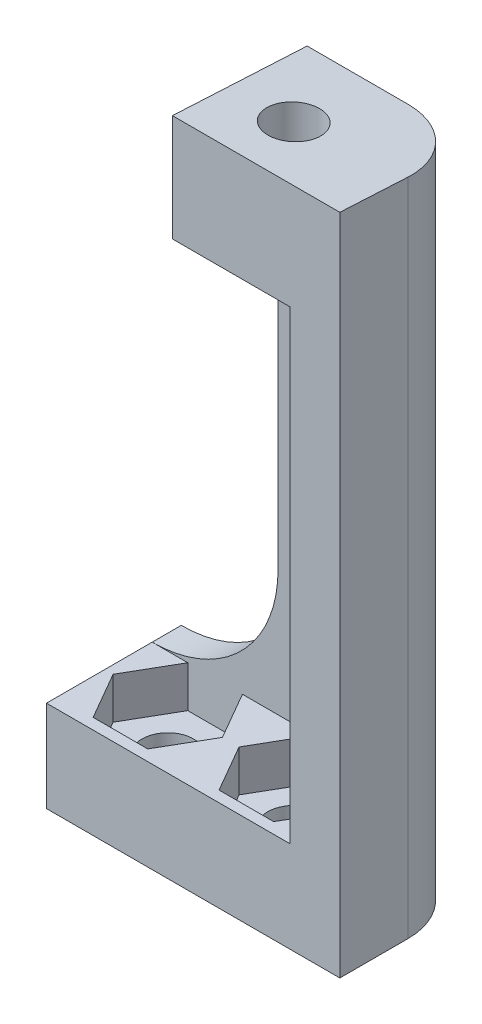
from build123d import *

# Parameters (mm, degrees)
SKETCH4_R                 = 1.55
BOSS_EXTRUDE4_DEPTH       = 3
BOSS_EXTRUDE5_START       = 3
BOSS_EXTRUDE5_DEPTH       = 2.5
BOSS_EXTRUDE6_START       = 5.5
BOSS_EXTRUDE6_DEPTH       = 31.423000022
BOSS_EXTRUDE6_START_2     = 116.532620121
BOSS_EXTRUDE6_2_OUTLINE_W = 13
BOSS_EXTRUDE6_2_OUTLINE_H = 11
BOSS_EXTRUDE6_2_DEPTH     = 1.467379879
BOSS_EXTRUDE7_START       = 36.497247904
BOSS_EXTRUDE7_OUTLINE_R   = 1.55
BOSS_EXTRUDE7_DEPTH       = 3.429880261
BOSS_EXTRUDE7_START_2     = 119.532620121
BOSS_EXTRUDE7_2_OUTLINE_W = 13
BOSS_EXTRUDE7_2_OUTLINE_H = 12
BOSS_EXTRUDE7_2_DEPTH     = 1.467379879
BOSS_EXTRUDE8_START       = 33.497248
BOSS_EXTRUDE8_DEPTH       = 3
SKETCH4_12_W              = 7.581793069
SKETCH4_12_H              = 8.112892266
SKETCH4_12_R              = 1.55
BOSS_EXTRUDE10_DEPTH      = 3
BOSS_EXTRUDE11_START      = 3
SKETCH4_13_W              = 7.581793069
SKETCH4_13_H              = 8.112892266
BOSS_EXTRUDE11_DEPTH      = 2.5
BOSS_EXTRUDE12_DEPTH      = 1.75


with BuildPart() as part:
    # Sketch4 → Boss-Extrude4 (new body)
    with BuildSketch(Plane(origin=(0, 73.681369419, 0), x_dir=(1, 0, 0), z_dir=(0, 1, 0))):
        with BuildLine():
            Line((-30.198456841, 124.133918355), (-24.116663772, 124.133918355))
            ThreePointArc((-24.116663772, 124.133918355), (-21.288236648, 122.96234548), (-20.116663772, 120.133918355))
            Line((-20.116663772, 120.133918355), (-20.116663772, 116.021026089))
            Line((-20.116663772, 116.021026089), (-30.198456841, 116.021026089))
            Line((-30.198456841, 116.021026089), (-30.198456841, 124.133918355))
        make_face()
        with Locations(Location((-26.407560307, 119.533918355, 0), (0, 0, 180))):
            Circle(SKETCH4_R, mode=Mode.SUBTRACT)
    extrude(amount=BOSS_EXTRUDE4_DEPTH)

    # Sketch4<5> → Boss-Extrude5 (add)
    with BuildSketch(Plane(origin=(0, 73.681369419, 0), x_dir=(1, 0, 0), z_dir=(0, 1, 0)).offset(BOSS_EXTRUDE5_START)):
        with BuildLine():
            Line((-24.116663772, 124.133918355), (-30.198456841, 124.133918355))
            Line((-30.198456841, 124.133918355), (-30.198456841, 122.383918355))
            Line((-30.198456841, 122.383918355), (-28.053008574, 122.383918355))
            Line((-28.053008574, 122.383918355), (-24.762112039, 122.383918355))
            Line((-24.762112039, 122.383918355), (-23.116663772, 119.533918355))
            Line((-23.116663772, 119.533918355), (-23.116663772, 116.021026089))
            Line((-23.116663772, 116.021026089), (-20.116663772, 116.021026089))
            Line((-20.116663772, 116.021026089), (-20.116663772, 120.133918355))
            ThreePointArc((-20.116663772, 120.133918355), (-21.288236648, 122.96234548), (-24.116663772, 124.133918355))
        make_face()
        Polygon((-28.053008574, 122.383918355), (-30.198456841, 122.383918355), (-30.198456841, 116.021026089), (-23.116663772, 116.021026089), (-23.116663772, 119.533918355), (-24.762112039, 116.683918355), (-28.053008574, 116.683918355), (-29.698456841, 119.533918355), align=None)
    extrude(amount=BOSS_EXTRUDE5_DEPTH)

    # Boss-Extrude6: read off the stored shape, not the designer's step
    # Boss-Extrude6 outline → Boss-Extrude6 (add)
    with BuildSketch(Plane(origin=(0, 73.681369419, 0), x_dir=(1, 0, 0), z_dir=(0, 1, 0)).offset(BOSS_EXTRUDE6_START)):
        with BuildLine():
            Line((-24.116663772, 124.133918355), (-30.198456841, 124.133918355))
            Line((-30.198456841, 124.133918355), (-30.198456841, 122.383918355))
            Line((-30.198456841, 122.383918355), (-24.762112039, 122.383918355))
            Line((-24.762112039, 122.383918355), (-23.116663772, 119.533918355))
            Line((-23.116663772, 119.533918355), (-23.116663772, 116.021026089))
            Line((-23.116663772, 116.021026089), (-20.116663772, 116.021026089))
            Line((-20.116663772, 116.021026089), (-20.116663772, 120.133918355))
            ThreePointArc((-20.116663772, 120.133918355), (-21.288236648, 122.96234548), (-24.116663772, 124.133918355))
        make_face()
    extrude(amount=BOSS_EXTRUDE6_DEPTH)

    # Boss-Extrude6 2 outline → Boss-Extrude6 2 (cut)
    with BuildSketch(Plane(origin=(0, 0, 0), x_dir=(1, 0, 0), z_dir=(0, 0.9986258431157963, -0.05240634943654381)).offset(BOSS_EXTRUDE6_START_2)):
        with Locations((-25.5, 114.5)):
            Rectangle(BOSS_EXTRUDE6_2_OUTLINE_W, BOSS_EXTRUDE6_2_OUTLINE_H)
    extrude(amount=BOSS_EXTRUDE6_2_DEPTH, mode=Mode.SUBTRACT)

    # Boss-Extrude7: read off the stored shape, not the designer's step
    # Boss-Extrude7 outline → Boss-Extrude7 (add)
    with BuildSketch(Plane(origin=(0, 73.681369419, 0), x_dir=(1, 0, 0), z_dir=(0, 1, 0)).offset(BOSS_EXTRUDE7_START)):
        with BuildLine():
            Line((-30.198456841, 116.021026089), (-20.116663772, 116.021026089))
            Line((-20.116663772, 116.021026089), (-20.116663772, 120.133918355))
            ThreePointArc((-20.116663772, 120.133918355), (-21.288236648, 122.96234548), (-24.116663772, 124.133918355))
            Line((-24.116663772, 124.133918355), (-30.198456841, 124.133918355))
            Line((-30.198456841, 124.133918355), (-30.198456841, 116.021026089))
        make_face()
        with Locations((-26.407560307, 119.533918355)):
            Circle(BOSS_EXTRUDE7_OUTLINE_R, mode=Mode.SUBTRACT)
    extrude(amount=BOSS_EXTRUDE7_DEPTH)

    # Boss-Extrude7 2 outline → Boss-Extrude7 2 (cut)
    with BuildSketch(Plane(origin=(0, 0, 0), x_dir=(1, 0, 0), z_dir=(0, 0.9986258431157963, -0.05240634943654381)).offset(BOSS_EXTRUDE7_START_2)):
        with Locations((-25.5, 114)):
            Rectangle(BOSS_EXTRUDE7_2_OUTLINE_W, BOSS_EXTRUDE7_2_OUTLINE_H)
    extrude(amount=BOSS_EXTRUDE7_2_DEPTH, mode=Mode.SUBTRACT)

    # Sketch4<10> → Boss-Extrude8 (add)
    with BuildSketch(Plane(origin=(0, 73.681369419, 0), x_dir=(1, 0, 0), z_dir=(0, 1, 0)).offset(BOSS_EXTRUDE8_START)):
        with BuildLine():
            Line((-24.116663772, 124.133918355), (-30.198456841, 124.133918355))
            Line((-30.198456841, 124.133918355), (-30.198456841, 122.383918355))
            Line((-30.198456841, 122.383918355), (-28.053008574, 122.383918355))
            Line((-28.053008574, 122.383918355), (-24.762112039, 122.383918355))
            Line((-24.762112039, 122.383918355), (-23.116663772, 119.533918355))
            Line((-23.116663772, 119.533918355), (-23.116663772, 116.021026089))
            Line((-23.116663772, 116.021026089), (-20.116663772, 116.021026089))
            Line((-20.116663772, 116.021026089), (-20.116663772, 120.133918355))
            ThreePointArc((-20.116663772, 120.133918355), (-21.288236648, 122.96234548), (-24.116663772, 124.133918355))
        make_face()
        Polygon((-28.053008574, 122.383918355), (-30.198456841, 122.383918355), (-30.198456841, 116.021026089), (-23.116663772, 116.021026089), (-23.116663772, 119.533918355), (-24.762112039, 116.683918355), (-28.053008574, 116.683918355), (-29.698456841, 119.533918355), align=None)
    extrude(amount=BOSS_EXTRUDE8_DEPTH)

    # Sketch4<12> → Boss-Extrude10 (add)
    # profile 1 of 2: a face of its own
    with BuildSketch(Plane(origin=(0, 73.681369419, 0), x_dir=(1, 0, 0), z_dir=(0, 1, 0))):
        with Locations((-33.989353376, 120.077472222)):
            Rectangle(SKETCH4_12_W, SKETCH4_12_H)
        Polygon((-32.343905108, 116.683918355), (-30.698456841, 119.533918355), (-32.343905108, 122.383918355), (-35.634801643, 122.383918355), (-37.28024991, 119.533918355), (-35.634801643, 116.683918355), align=None, mode=Mode.SUBTRACT)
    # profile 2 of 2: a face of its own
    with BuildSketch(Plane(origin=(0, 73.681369419, 0), x_dir=(1, 0, 0), z_dir=(0, 1, 0))):
        Polygon((-35.634801643, 116.683918355), (-32.343905108, 116.683918355), (-30.698456841, 119.533918355), (-32.343905108, 122.383918355), (-35.634801643, 122.383918355), (-37.28024991, 119.533918355), align=None)
        with Locations(Location((-33.989353375, 119.533918355, 0), (0, 0, 180))):
            Circle(SKETCH4_12_R, mode=Mode.SUBTRACT)
    extrude(amount=BOSS_EXTRUDE10_DEPTH)

    # Sketch4<13> → Boss-Extrude11 (add)
    with BuildSketch(Plane(origin=(0, 73.681369419, 0), x_dir=(1, 0, 0), z_dir=(0, 1, 0)).offset(BOSS_EXTRUDE11_START)):
        with Locations((-33.989353376, 120.077472222)):
            Rectangle(SKETCH4_13_W, SKETCH4_13_H)
        Polygon((-32.343905108, 116.683918355), (-30.698456841, 119.533918355), (-32.343905108, 122.383918355), (-35.634801643, 122.383918355), (-37.28024991, 119.533918355), (-35.634801643, 116.683918355), align=None, mode=Mode.SUBTRACT)
    extrude(amount=BOSS_EXTRUDE11_DEPTH)

    # Sketch7 → Boss-Extrude12 (add)
    with BuildSketch(Plane(origin=(0, 0, -124.133918355), x_dir=(-1, 0, 0), z_dir=(0, 0, -1))):
        with BuildLine():
            Line((30.198456841, 79.181369419), (37.78024991, 79.181369419))
            ThreePointArc((37.78024991, 79.181369419), (32.419112617, 81.402025196), (30.198456841, 86.763162488))
            Line((30.198456841, 86.763162488), (30.198456841, 79.181369419))
        make_face()
    extrude(amount=-BOSS_EXTRUDE12_DEPTH)


solid = part.part
